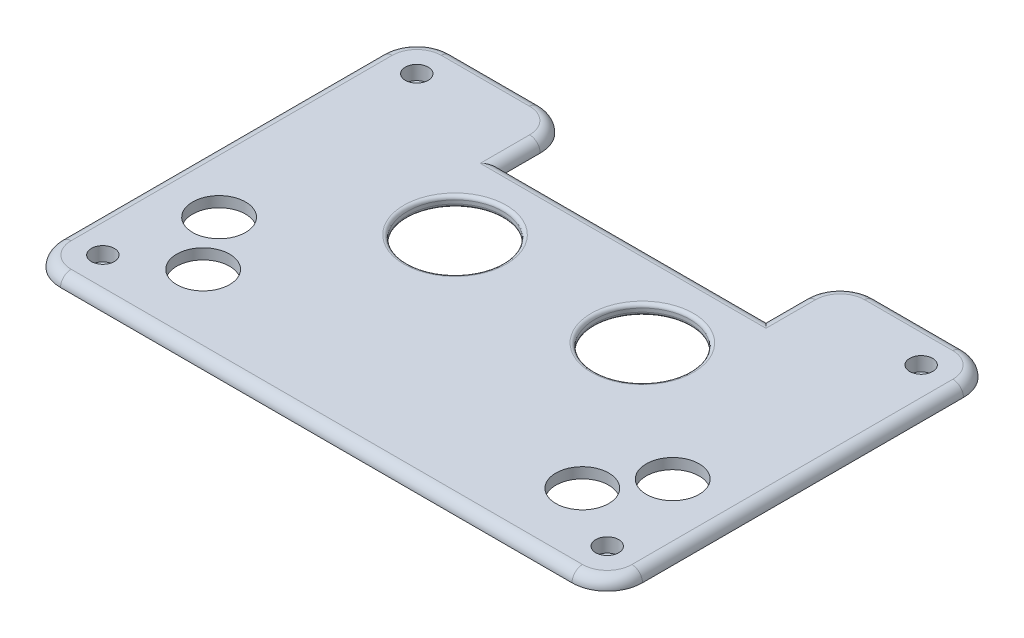
from build123d import *

# Parameters (mm, degrees)
BOSS_EXTRUDE1_DEPTH = 3
FILLET1_R           = 10
FILLET4_R           = 10
BOSS_EXTRUDE4_DEPTH = 6.9
FILLET5_R           = 3
SKETCH7_R           = 2
CUT_EXTRUDE2_DEPTH  = 100.670005518
SKETCH8_R           = 3.25
CUT_EXTRUDE3_DEPTH  = 4
SKETCH3_R           = 13.5
CUT_EXTRUDE4_DEPTH  = 100.670005518
FILLET6_R           = 1
SKETCH5_R           = 7.5
CUT_EXTRUDE5_DEPTH  = 100.670005518
FILLET7_R           = 1.9


with BuildPart() as part:
    # Sketch1 → Boss-Extrude1 (new body)
    with BuildSketch(Plane(origin=(0, 0, 0), x_dir=(1, 0, 0), z_dir=(0, 1, 0))):
        Polygon((37.5, 55.5), (37.5, 34.5), (-37.5, 34.5), (-37.5, 55.5), (-82.5, 55.5), (-82.5, -55.5), (82.5, -55.5), (82.5, 55.5), align=None)
    extrude(amount=BOSS_EXTRUDE1_DEPTH)

    # Fillet1
    fillet1_edges = [part.edges().sort_by_distance(p)[0] for p in [
        (82.5, 1.5, 55.5),
        (-82.5, 1.5, 55.5),
    ]]
    fillet(fillet1_edges, radius=FILLET1_R)

    # Fillet4
    fillet4_edges = [part.edges().sort_by_distance(p)[0] for p in [
        (-82.5, 1.5, -55.5),
        (-37.5, 1.5, -55.5),
        (37.5, 1.5, -55.5),
        (82.5, 1.5, -55.5),
    ]]
    fillet(fillet4_edges, radius=FILLET4_R)

    # Sketch6 → Boss-Extrude4 (add)
    with BuildSketch(Plane(origin=(0, 3, 0), x_dir=(1, 0, 0), z_dir=(0, 1, 0))):
        with BuildLine():
            Line((76.5, 39.5), (66.5, 39.5))
            Line((66.5, 39.5), (66.5, 49.5))
            Line((66.5, 49.5), (72.5, 49.5))
            ThreePointArc((72.5, 49.5), (75.328427125, 48.328427125), (76.5, 45.5))
            Line((76.5, 45.5), (76.5, 39.5))
        make_face()
        with BuildLine():
            Line((76.5, -45.5), (76.5, -39.5))
            Line((76.5, -39.5), (66.5, -39.5))
            Line((66.5, -39.5), (66.5, -49.5))
            Line((66.5, -49.5), (72.5, -49.5))
            ThreePointArc((72.5, -49.5), (75.328427125, -48.328427125), (76.5, -45.5))
        make_face()
        with BuildLine():
            Line((-76.5, 39.5), (-66.5, 39.5))
            Line((-66.5, 39.5), (-66.5, 49.5))
            Line((-66.5, 49.5), (-72.5, 49.5))
            ThreePointArc((-72.5, 49.5), (-75.328427125, 48.328427125), (-76.5, 45.5))
            Line((-76.5, 45.5), (-76.5, 39.5))
        make_face()
        with BuildLine():
            Line((-72.5, -49.5), (-66.5, -49.5))
            Line((-66.5, -49.5), (-66.5, -39.5))
            Line((-66.5, -39.5), (-76.5, -39.5))
            Line((-76.5, -39.5), (-76.5, -45.5))
            ThreePointArc((-76.5, -45.5), (-75.328427125, -48.328427125), (-72.5, -49.5))
        make_face()
    extrude(amount=-BOSS_EXTRUDE4_DEPTH)

    # Fillet5
    fillet5_edges = [part.edges().sort_by_distance(p)[0] for p in [
        (-37.5, 3, -40),
        (-40.428932188, 3, -52.571067812),
        (-60, 3, -55.5),
        (-79.571067812, 3, -52.571067812),
        (-82.5, 3, 0),
        (-79.571067812, 3, 52.571067812),
        (0, 3, 55.5),
        (79.571067812, 3, 52.571067812),
        (82.5, 3, 0),
        (79.571067812, 3, -52.571067812),
        (37.5, 3, -40),
        (40.428932188, 3, -52.571067812),
        (0, 3, -34.5),
        (60, 3, -55.5),
    ]]
    fillet(fillet5_edges, radius=FILLET5_R - 0.0001)  # a hair under: the kernel refuses the full size

    # Sketch7 → Cut-Extrude2 (cut, through all)
    with BuildSketch(Plane.XZ.offset(3.9)):
        with Locations(Location((71.5, -44.5, 0), (0, 0, 270))):
            Circle(SKETCH7_R)
        with Locations(Location((-71.5, -44.5, 0), (0, 0, 270))):
            Circle(SKETCH7_R)
        with Locations(Location((-71.5, 44.5, 0), (0, 0, 270))):
            Circle(SKETCH7_R)
        with Locations(Location((71.5, 44.5, 0), (0, 0, 270))):
            Circle(SKETCH7_R)
    extrude(amount=-CUT_EXTRUDE2_DEPTH, mode=Mode.SUBTRACT)

    # Sketch8 → Cut-Extrude3 (cut)
    with BuildSketch(Plane(origin=(0, 3, 0), x_dir=(1, 0, 0), z_dir=(0, 1, 0))):
        with Locations(Location((71.5, 44.5, 0), (0, 0, 270))):
            Circle(SKETCH8_R)
        with Locations(Location((71.5, -44.5, 0), (0, 0, 90))):
            Circle(SKETCH8_R)
        with Locations(Location((-71.5, -44.5, 0), (0, 0, 270))):
            Circle(SKETCH8_R)
        with Locations(Location((-71.5, 44.5, 0), (0, 0, 90))):
            Circle(SKETCH8_R)
    extrude(amount=-CUT_EXTRUDE3_DEPTH, mode=Mode.SUBTRACT)

    # Sketch3 → Cut-Extrude4 (cut, through all)
    with BuildSketch(Plane(origin=(0, 3, 0), x_dir=(1, 0, 0), z_dir=(0, 1, 0))):
        with Locations(Location((26.55, 10.405419746, 0), (0, 0, 270))):
            Circle(SKETCH3_R)
        with Locations(Location((-26.55, 10.405419746, 0), (0, 0, 270))):
            Circle(SKETCH3_R)
    extrude(amount=-CUT_EXTRUDE4_DEPTH, mode=Mode.SUBTRACT)

    # Fillet6
    fillet6_edges = [part.edges().sort_by_distance(p)[0] for p in [
        (26.55, 0, -23.905419746),
        (26.55, 3, -23.905419746),
        (-26.55, 0, -23.905419746),
        (-26.55, 3, -23.905419746),
    ]]
    fillet(fillet6_edges, radius=FILLET6_R)

    # Sketch5 → Cut-Extrude5 (cut, through all)
    with BuildSketch(Plane(origin=(0, 3, 0), x_dir=(1, 0, 0), z_dir=(0, 1, 0))):
        with Locations(Location((-53.749360759, -33.813881578, 0), (0, 0, 270))):
            Circle(SKETCH5_R)
        with Locations(Location((-64.303167187, -18.741483963, 0), (0, 0, 270))):
            Circle(SKETCH5_R)
        with Locations(Location((64.303167187, -18.741483963, 0), (0, 0, 270))):
            Circle(SKETCH5_R)
        with Locations(Location((53.749360759, -33.813881578, 0), (0, 0, 270))):
            Circle(SKETCH5_R)
    extrude(amount=-CUT_EXTRUDE5_DEPTH, mode=Mode.SUBTRACT)

    # Fillet7
    fillet7_edges = [part.edges().sort_by_distance(p)[0] for p in [
        (-71.5, 0, -39.5),
        (-66.5, 0, -44.5),
        (-69.5, 0, -49.5),
        (-75.328427125, 0, -48.328427125),
        (-76.5, 0, -42.5),
        (-69.5, 0, 49.5),
        (-66.5, 0, 44.5),
        (-71.5, 0, 39.5),
        (-76.5, 0, 42.5),
        (-75.328427125, 0, 48.328427125),
        (71.5, 0, -39.5),
        (76.5, 0, -42.5),
        (75.328427125, 0, -48.328427125),
        (69.5, 0, -49.5),
        (66.5, 0, -44.5),
        (76.5, 0, 42.5),
        (71.5, 0, 39.5),
        (66.5, 0, 44.5),
        (69.5, 0, 49.5),
        (75.328427125, 0, 48.328427125),
    ]]
    fillet(fillet7_edges, radius=FILLET7_R)


solid = part.part
